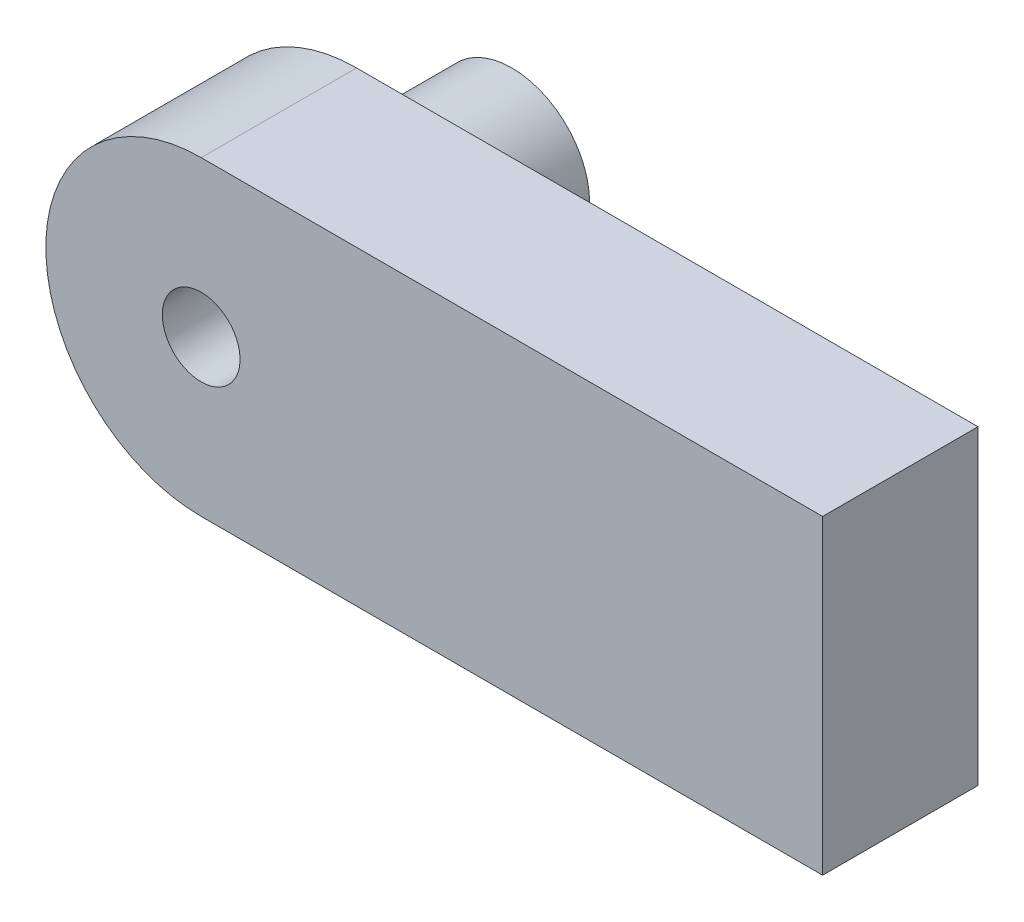
from build123d import *

# Parameters (mm, degrees)
ESTRUSIONE_ESTRUSIONE1_DEPTH = 5
SCHIZZO2_R                   = 2.5
ESTRUSIONE_ESTRUSIONE2_DEPTH = 5
SCHIZZO3_R                   = 1.25
TAGLIO_ESTRUSIONE1_DEPTH     = 28.481102698


with BuildPart() as part:
    # Schizzo1 → Estrusione-Estrusione1 (new body)
    with BuildSketch(Plane.XY):
        with BuildLine():
            Line((0, 4.503546099), (-20, 4.503546099))
            ThreePointArc((-20, 4.503546099), (-25, -0.496453901), (-20, -5.496453901))
            Line((-20, -5.496453901), (0, -5.496453901))
            Line((0, -5.496453901), (0, 4.503546099))
        make_face()
    extrude(amount=ESTRUSIONE_ESTRUSIONE1_DEPTH)

    # Schizzo2 → Estrusione-Estrusione2 (add)
    with BuildSketch(Plane(origin=(0, 0, 0), x_dir=(-1, 0, 0), z_dir=(0, 0, -1))):
        with Locations((20, -0.496453901)):
            Circle(SCHIZZO2_R)
    extrude(amount=ESTRUSIONE_ESTRUSIONE2_DEPTH)

    # Schizzo3 → Taglio-Estrusione1 (cut, through all)
    with BuildSketch(Plane(origin=(0, 0, -5), x_dir=(-1, 0, 0), z_dir=(0, 0, -1))):
        with Locations((20, -0.496453901)):
            Circle(SCHIZZO3_R)
    extrude(amount=-TAGLIO_ESTRUSIONE1_DEPTH, mode=Mode.SUBTRACT)


solid = part.part
